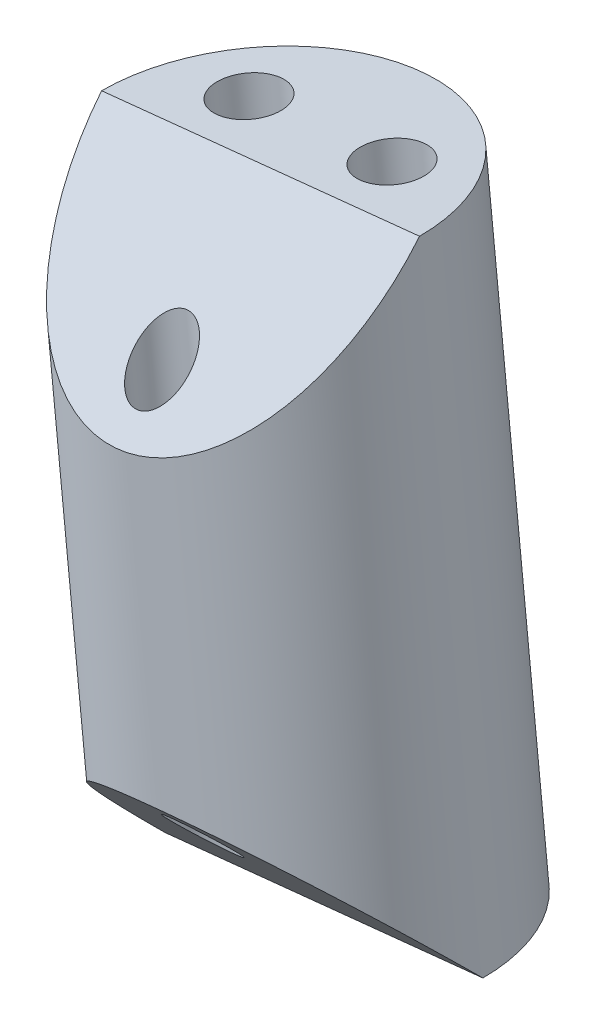
from build123d import *

# Parameters (mm, degrees)
SKETCH3_R               = 8
BOSS_EXTRUDE1_DEPTH     = 30.735789474
CUT_EXTRUDE1_DEPTH      = 200.187264303
CUT_EXTRUDE1_DEPTH_BACK = 200.187264303
CUT_EXTRUDE3_DEPTH      = 39.023226967
CUT_EXTRUDE3_DEPTH_BACK = 39.023226967
SKETCH8_R               = 1.4
SKETCH8_R_2             = 1.6


with BuildPart() as part:
    # Sketch3 → Boss-Extrude1 (new body)
    with BuildSketch(Plane(origin=(-20.344467381, 196.178792599, 0), x_dir=(-0.9946657577296572, -0.10315052302381678, 0), z_dir=(0.10315052302381678, -0.9946657577296572, 0))):
        with Locations((-10.431405186, 0)):
            Circle(SKETCH3_R)
    extrude(amount=BOSS_EXTRUDE1_DEPTH)

    # Sketch4 → Cut-Extrude1 (cut, two sides: drawn at the far end of the back side and taken through both)
    with BuildSketch(Plane(origin=(10.375761543, 1.076004901, 0), x_dir=(0.10315052302381672, -0.9946657577296572, 0), z_dir=(-0.9946657577296572, -0.10315052302381673, 0)).offset(-CUT_EXTRUDE1_DEPTH_BACK)):
        Polygon((-197.230869842, 0), (-189.230869842, 8), (-197.230869842, 8), align=None)
        Polygon((-174.495080368, 8), (-166.495080368, 8), (-166.495080368, 0), align=None)
    extrude(amount=CUT_EXTRUDE1_DEPTH + CUT_EXTRUDE1_DEPTH_BACK, mode=Mode.SUBTRACT)

    # Sketch8 → Cut-Extrude3 (cut, two sides: drawn at the far end of the back side and taken through both)
    with BuildSketch(Plane(origin=(-20.344467381, 196.178792599, 0), x_dir=(0.9946657577296572, 0.10315052302381678, 0), z_dir=(-0.10315052302381678, 0.9946657577296572, 0)).offset(-CUT_EXTRUDE3_DEPTH_BACK)):
        with Locations((10.431405186, -5.5)):
            Circle(SKETCH8_R)
        with Locations((6.831405186, 3)):
            Circle(SKETCH8_R_2)
        with Locations((14.031405186, 3)):
            Circle(SKETCH8_R_2)
    extrude(amount=CUT_EXTRUDE3_DEPTH + CUT_EXTRUDE3_DEPTH_BACK, mode=Mode.SUBTRACT)


solid = part.part
